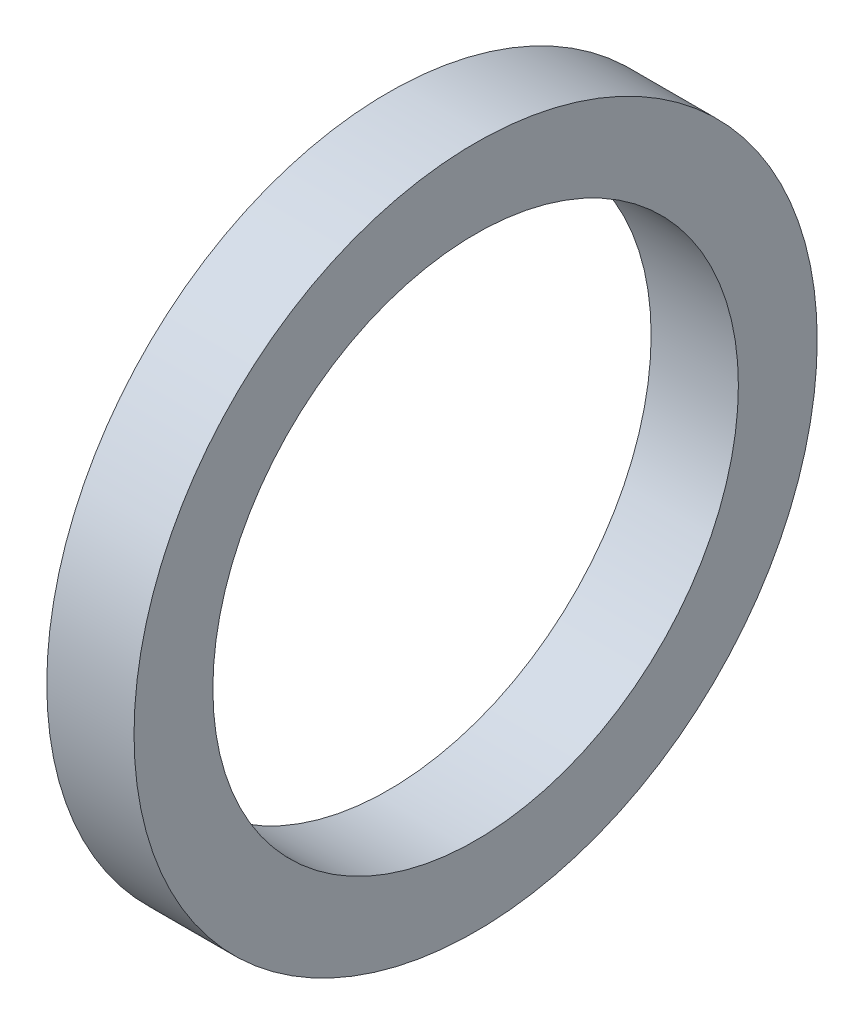
from build123d import *

# Parameters (mm, degrees)
SKETCH3_W = 9.959999892
SKETCH3_H = 9.000000034


with BuildPart() as part:
    # Sketch3 → Revolve1 (revolve)
    with BuildSketch(Plane.XY):
        with Locations((-6.780000156, 34.499999961)):
            Rectangle(SKETCH3_W, SKETCH3_H)
    revolve(axis=Axis((0, 0, 0), (1, 0, 0)))


solid = part.part
